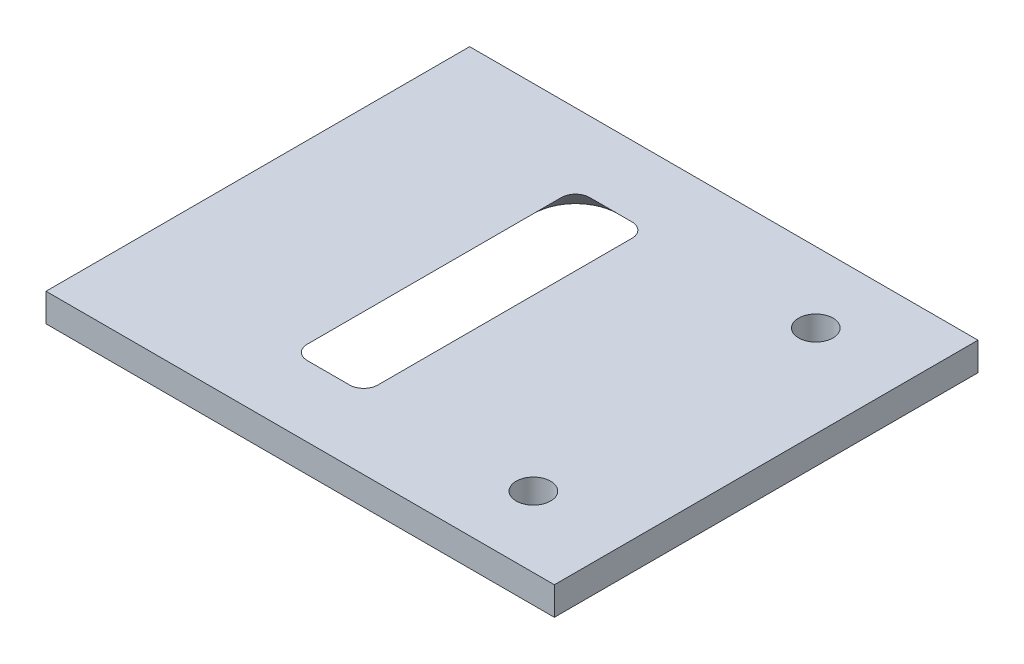
from build123d import *

# Parameters (mm, degrees)
SKETCH2_W             = 36
SKETCH2_H             = 30
BOSS_EXTRUDE1_DEPTH   = 2
CUT_EXTRUDE4_DEPTH    = 26.884358211
CUT_EXTRUDE4_DRAFT    = 45
F_2_CLEARANCE_HOLE1_D = 2.4384


with BuildPart() as part:
    # Sketch2 → Boss-Extrude1 (new body)
    with BuildSketch(Plane(origin=(0, 0, 0), x_dir=(1, 0, 0), z_dir=(0, 1, 0))):
        with Locations((3, 0)):
            Rectangle(SKETCH2_W, SKETCH2_H)
    extrude(amount=BOSS_EXTRUDE1_DEPTH)


with BuildPart() as cut_extrude4_tool:
    # Sketch4 → Cut-Extrude4 (with draft: the straight prism first)
    with BuildSketch(Plane(origin=(0, 2, 0), x_dir=(1, 0, 0), z_dir=(0, 1, 0))):
        with BuildLine():
            ThreePointArc((1.5, -10), (2.207106781, -9.707106781), (2.5, -9))
            Line((2.5, -9), (2.5, 9))
            ThreePointArc((2.5, 9), (2.207106781, 9.707106781), (1.5, 10))
            Line((1.5, 10), (-1.5, 10))
            ThreePointArc((-1.5, 10), (-2.207106781, 9.707106781), (-2.5, 9))
            Line((-2.5, 9), (-2.5, -9))
            ThreePointArc((-2.5, -9), (-2.207106781, -9.707106781), (-1.5, -10))
            Line((-1.5, -10), (1.5, -10))
        make_face()
    extrude(amount=-CUT_EXTRUDE4_DEPTH)
    # Cut-Extrude4: the draft: its side faces are tilted about the plane it starts from
    cut_extrude4_sides = [cut_extrude4_tool.faces().sort_by_distance(p)[0] for p in [
        (-2.207106781, -11.442179106, 9.707106781),
        (0, -11.442179106, 10),
        (2.207106781, -11.442179106, 9.707106781),
        (2.5, -11.442179106, 0),
        (2.207106781, -11.442179106, -9.707106781),
        (0, -11.442179106, -10),
        (-2.207106781, -11.442179106, -9.707106781),
        (-2.5, -11.442179106, 0),
    ]]
    draft(cut_extrude4_sides, Plane(origin=(0, 2, 0), x_dir=(1, 0, 0), z_dir=(0, 1, 0)), CUT_EXTRUDE4_DRAFT)


with BuildPart() as part_1:
    add(part.part)

    # Cut-Extrude4: cut by cut_extrude4_tool
    add(cut_extrude4_tool.part, mode=Mode.SUBTRACT)

    # #2 Clearance Hole1 (through all)
    with Locations(Plane(origin=(0, 0, 0), x_dir=(-1, 0, 0), z_dir=(0, -1, 0))):
        with Locations((-14.513821803, -10), (-14.513821803, 10)):
            Hole(F_2_CLEARANCE_HOLE1_D / 2)


solid = part_1.part
